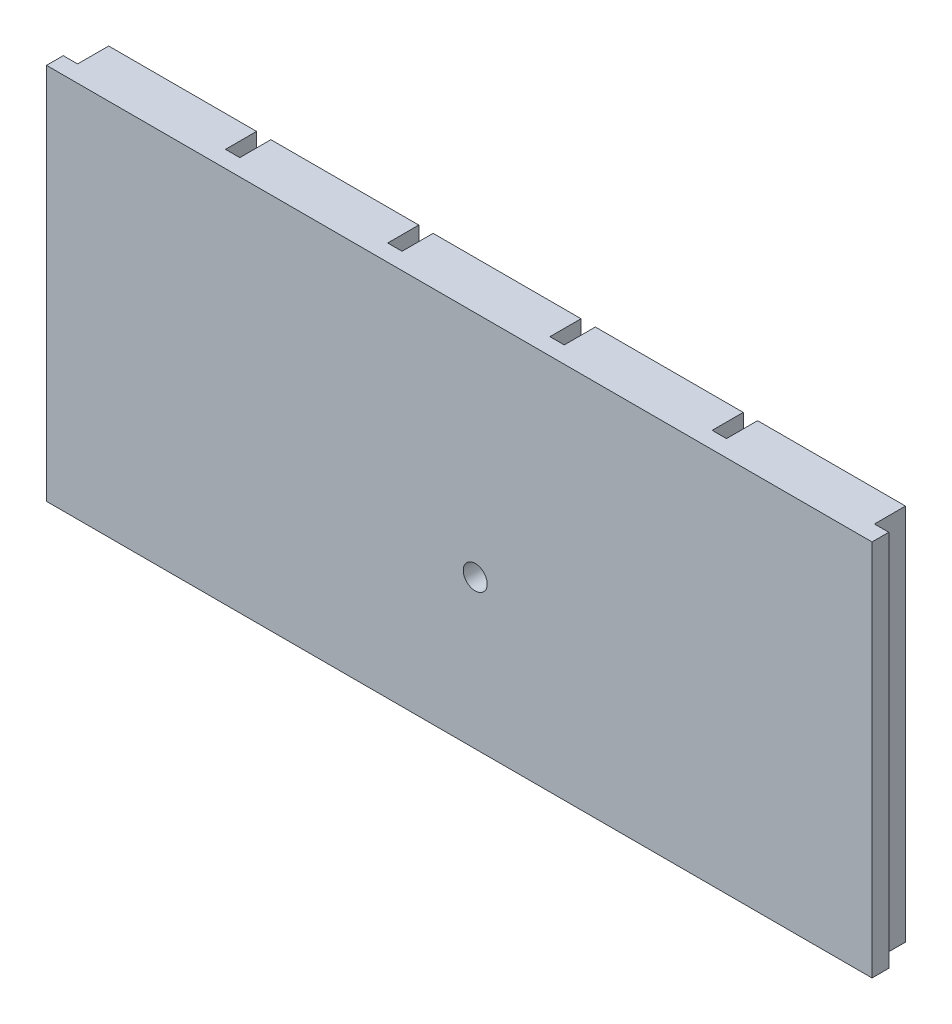
from build123d import *

# Parameters (mm, degrees)
SKETCH1_W           = 172.688303012
SKETCH1_H           = 79
SKETCH1_R           = 2.5
BOSS_EXTRUDE1_DEPTH = 10
CUT_EXTRUDE1_REACH  = 119.458
SKETCH2_W           = 3
SKETCH2_H           = 6.5


with BuildPart() as part:
    # Sketch1 → Boss-Extrude1 (new body)
    with BuildSketch(Plane.XY):
        Rectangle(SKETCH1_W, SKETCH1_H)
        with Locations((3.337204705, -8.386778216)):
            Circle(SKETCH1_R, mode=Mode.SUBTRACT)
    extrude(amount=BOSS_EXTRUDE1_DEPTH)

    # Sketch2 → Cut-Extrude1 (cut, up to next)
    with BuildSketch(Plane(origin=(0, 39.5, 0), x_dir=(1, 0, 0), z_dir=(0, 1, 0)), mode=Mode.PRIVATE) as cut_extrude1_sk1:
        with Locations((84.844151506, -3.25)):
            Rectangle(SKETCH2_W, SKETCH2_H)
    cut_extrude1_tool1 = extrude(cut_extrude1_sk1.sketch, amount=-CUT_EXTRUDE1_REACH, mode=Mode.PRIVATE) & part.part
    # Sketch2 → Cut-Extrude1 (cut, up to next)
    with BuildSketch(Plane(origin=(0, 39.5, 0), x_dir=(1, 0, 0), z_dir=(0, 1, 0)), mode=Mode.PRIVATE) as cut_extrude1_sk2:
        with Locations((50.906490903, -3.25)):
            Rectangle(SKETCH2_W, SKETCH2_H)
    cut_extrude1_tool2 = extrude(cut_extrude1_sk2.sketch, amount=-CUT_EXTRUDE1_REACH, mode=Mode.PRIVATE) & part.part
    # Sketch2 → Cut-Extrude1 (cut, up to next)
    with BuildSketch(Plane(origin=(0, 39.5, 0), x_dir=(1, 0, 0), z_dir=(0, 1, 0)), mode=Mode.PRIVATE) as cut_extrude1_sk3:
        with Locations((16.968830301, -3.25)):
            Rectangle(SKETCH2_W, SKETCH2_H)
    cut_extrude1_tool3 = extrude(cut_extrude1_sk3.sketch, amount=-CUT_EXTRUDE1_REACH, mode=Mode.PRIVATE) & part.part
    # Sketch2 → Cut-Extrude1 (cut, up to next)
    with BuildSketch(Plane(origin=(0, 39.5, 0), x_dir=(1, 0, 0), z_dir=(0, 1, 0)), mode=Mode.PRIVATE) as cut_extrude1_sk4:
        with Locations((-16.968830301, -3.25)):
            Rectangle(SKETCH2_W, SKETCH2_H)
    cut_extrude1_tool4 = extrude(cut_extrude1_sk4.sketch, amount=-CUT_EXTRUDE1_REACH, mode=Mode.PRIVATE) & part.part
    # Sketch2 → Cut-Extrude1 (cut, up to next)
    with BuildSketch(Plane(origin=(0, 39.5, 0), x_dir=(1, 0, 0), z_dir=(0, 1, 0)), mode=Mode.PRIVATE) as cut_extrude1_sk5:
        with Locations((-50.906490903, -3.25)):
            Rectangle(SKETCH2_W, SKETCH2_H)
    cut_extrude1_tool5 = extrude(cut_extrude1_sk5.sketch, amount=-CUT_EXTRUDE1_REACH, mode=Mode.PRIVATE) & part.part
    # Sketch2 → Cut-Extrude1 (cut, up to next)
    with BuildSketch(Plane(origin=(0, 39.5, 0), x_dir=(1, 0, 0), z_dir=(0, 1, 0)), mode=Mode.PRIVATE) as cut_extrude1_sk6:
        with Locations((-84.844151506, -3.25)):
            Rectangle(SKETCH2_W, SKETCH2_H)
    cut_extrude1_tool6 = extrude(cut_extrude1_sk6.sketch, amount=-CUT_EXTRUDE1_REACH, mode=Mode.PRIVATE) & part.part
    add(cut_extrude1_tool1.solids().sort_by_distance((84.844152, 39.5, 3.25))[0], mode=Mode.SUBTRACT)
    add(cut_extrude1_tool2.solids().sort_by_distance((50.906491, 39.5, 3.25))[0], mode=Mode.SUBTRACT)
    add(cut_extrude1_tool3.solids().sort_by_distance((16.96883, 39.5, 3.25))[0], mode=Mode.SUBTRACT)
    add(cut_extrude1_tool4.solids().sort_by_distance((-16.96883, 39.5, 3.25))[0], mode=Mode.SUBTRACT)
    add(cut_extrude1_tool5.solids().sort_by_distance((-50.906491, 39.5, 3.25))[0], mode=Mode.SUBTRACT)
    add(cut_extrude1_tool6.solids().sort_by_distance((-84.844152, 39.5, 3.25))[0], mode=Mode.SUBTRACT)


solid = part.part
